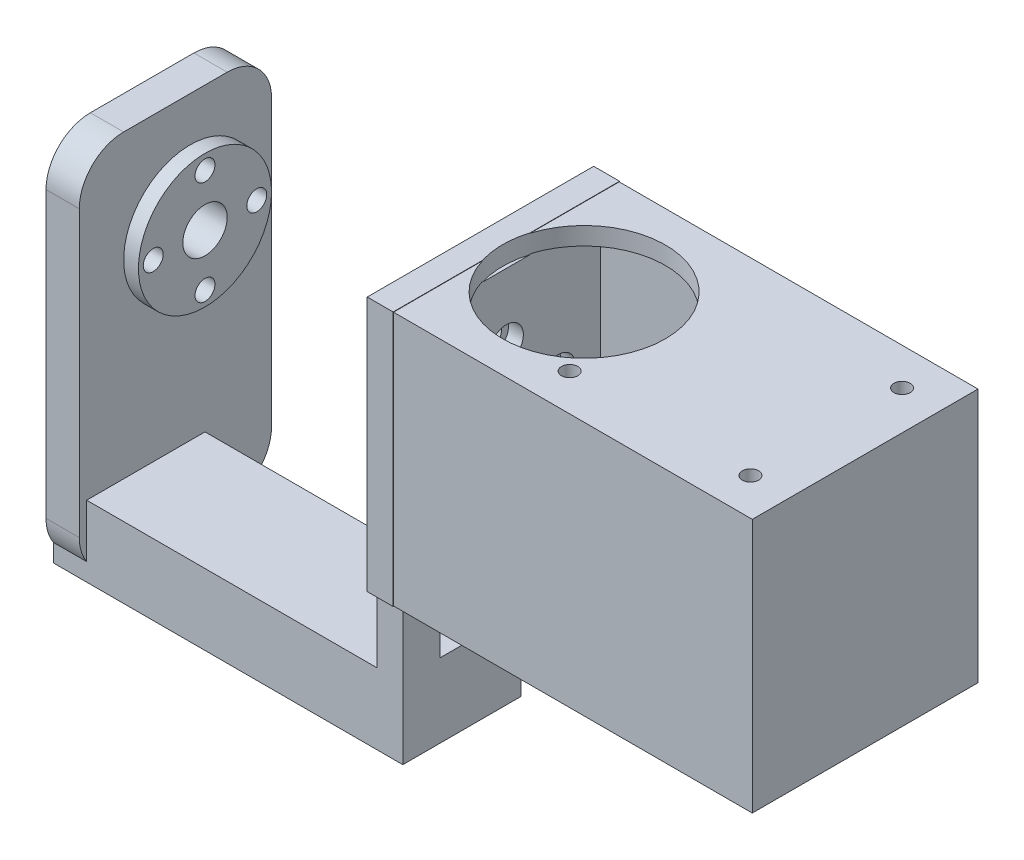
from build123d import *

# Parameters (mm, degrees)
S_PRISM1_W    = 30.62
S_PRISM1_H    = 34.5
BOSS_1_DEPTH  = 3.5
S_CYL2_R      = 9
BOSS_2_DEPTH  = 2
BOSS_3_DEPTH  = 4.5
S_BOX4_W      = 2.5
S_BOX4_H      = 34.4
BOSS_4_DEPTH  = 30.52
S_BOX5_W      = 2.5
S_BOX5_H      = 34.4
BOSS_5_DEPTH  = 30.52
S_BOX6_W      = 51.02
S_BOX6_H      = 34.4
BOSS_6_DEPTH  = 2.5
S_BOX7_W      = 51.02
S_BOX7_H      = 34.4
BOSS_7_DEPTH  = 2.5
S_BOX8_W      = 51.02
S_BOX8_H      = 2.4
BOSS_8_DEPTH  = 30.52
S_BOX9_W      = 3.5
S_BOX9_H      = 9.725
BOSS_9_DEPTH  = 5
S_BOX10_W     = 3.5
S_BOX10_H     = 10
BOSS_10_DEPTH = 16
S_BOX11_W     = 47.25
S_BOX11_H     = 9.6
BOSS_11_DEPTH = 16
S_HOLE12_R    = 3
HOLE_12_DEPTH = 3.7
S_HOLE13_R    = 1.35
HOLE_13_DEPTH = 3.7
S_HOLE14_R    = 1.35
HOLE_14_DEPTH = 3.7
S_HOLE15_R    = 1.35
HOLE_15_DEPTH = 3.7
S_HOLE16_R    = 1.35
HOLE_16_DEPTH = 3.7
S_HOLE17_R    = 3
HOLE_17_DEPTH = 6.7
S_HOLE18_R    = 1.35
HOLE_18_DEPTH = 6.7
S_HOLE19_R    = 1.35
HOLE_19_DEPTH = 6.7
S_HOLE20_R    = 1.35
HOLE_20_DEPTH = 6.7
S_HOLE21_R    = 1.35
HOLE_21_DEPTH = 6.7
S_HOLE22_R    = 11
HOLE_22_DEPTH = 2.6
S_HOLE23_R    = 1.1
HOLE_23_DEPTH = 2.6
S_HOLE24_R    = 1.1
HOLE_24_DEPTH = 2.6
S_HOLE25_R    = 1.1
HOLE_25_DEPTH = 2.6
S_HOLE26_R    = 2.3
HOLE_26_DEPTH = 2.1
S_HOLE27_R    = 2.3
HOLE_27_DEPTH = 2.1
S_HOLE28_R    = 2.3
HOLE_28_DEPTH = 2.1
S_HOLE29_R    = 2.3
HOLE_29_DEPTH = 2.1


with BuildPart() as part:
    # S_prism1 → Boss_1 (new body)
    with BuildSketch(Plane(origin=(-14.01, 0, 0), x_dir=(0, 0, -1), z_dir=(1, 0, 0))):
        with Locations((0, 1.2)):
            Rectangle(S_PRISM1_W, S_PRISM1_H)
    extrude(amount=BOSS_1_DEPTH)

    # S_box4 → Boss_4 (add)
    with BuildSketch(Plane.XY.offset(-15.26)):
        with Locations((-11.76, 1.2)):
            Rectangle(S_BOX4_W, S_BOX4_H)
    extrude(amount=BOSS_4_DEPTH)



with BuildPart() as body_2:
    # S_cyl2 → Boss_2 (new body)
    with BuildSketch(Plane(origin=(-53.26, 0, 0), x_dir=(0, 0, -1), z_dir=(1, 0, 0))):
        Circle(S_CYL2_R)
    extrude(amount=BOSS_2_DEPTH)

    # S_prism3 → Boss_3 (add)
    with BuildSketch(Plane(origin=(-57.76, 0, 0), x_dir=(0, 0, -1), z_dir=(1, 0, 0))):
        with BuildLine():
            Line((11, 9), (11, -29.5))
            ThreePointArc((11, -29.5), (9.2426, -33.7426), (5, -35.5))
            Line((5, -35.5), (-9, -35.5))
            ThreePointArc((-9, -35.5), (-13.2426, -33.7426), (-15, -29.5))
            Line((-15, -29.5), (-15, 9))
            ThreePointArc((-15, 9), (-13.2426, 13.2426), (-9, 15))
            Line((-9, 15), (5, 15))
            ThreePointArc((5, 15), (9.2426, 13.2426), (11, 9))
        make_face()
    extrude(amount=BOSS_3_DEPTH)


with BuildPart() as body_3:
    # S_box5 → Boss_5 (new body)
    with BuildSketch(Plane.XY.offset(-15.26)):
        with Locations((36.76, 1.2)):
            Rectangle(S_BOX5_W, S_BOX5_H)
    extrude(amount=BOSS_5_DEPTH)


with BuildPart() as part_1:
    add(part.part)

    add(body_3.part)  # Boss_6 merges body 3
    # S_box6 → Boss_6 (add)
    with BuildSketch(Plane.XY.offset(-15.26)):
        with Locations((12.5, 1.2)):
            Rectangle(S_BOX6_W, S_BOX6_H)
    extrude(amount=BOSS_6_DEPTH)

    # S_box7 → Boss_7 (add)
    with BuildSketch(Plane.XY.offset(12.76)):
        with Locations((12.5, 1.2)):
            Rectangle(S_BOX7_W, S_BOX7_H)
    extrude(amount=BOSS_7_DEPTH)

    # S_box8 → Boss_8 (add)
    with BuildSketch(Plane.XY.offset(-15.26)):
        with Locations((12.5, 17.2)):
            Rectangle(S_BOX8_W, S_BOX8_H)
    extrude(amount=BOSS_8_DEPTH)

    # S_box9 → Boss_9 (add)
    with BuildSketch(Plane.XY.offset(9)):
        with Locations((-12.26, -20.8625)):
            Rectangle(S_BOX9_W, S_BOX9_H)
    extrude(amount=BOSS_9_DEPTH)

    # S_box10 → Boss_10 (add)
    with BuildSketch(Plane.XY.offset(-2)):
        with Locations((-12.26, -30.225)):
            Rectangle(S_BOX10_W, S_BOX10_H)
    extrude(amount=BOSS_10_DEPTH)


    add(body_2.part)  # Boss_11 merges body 2
    # S_box11 → Boss_11 (add)
    with BuildSketch(Plane.XY.offset(-2)):
        with Locations((-34.135, -30.425)):
            Rectangle(S_BOX11_W, S_BOX11_H)
    extrude(amount=BOSS_11_DEPTH)

    # S_hole12 → Hole_12 (cut)
    with BuildSketch(Plane(origin=(-14.11, 0, 0), x_dir=(0, 0, -1), z_dir=(1, 0, 0))):
        Circle(S_HOLE12_R)
    extrude(amount=HOLE_12_DEPTH, mode=Mode.SUBTRACT)

    # S_hole13 → Hole_13 (cut)
    with BuildSketch(Plane(origin=(-14.11, 0, 0), x_dir=(0, 0, -1), z_dir=(1, 0, 0))):
        with Locations((0, -7)):
            Circle(S_HOLE13_R)
    extrude(amount=HOLE_13_DEPTH, mode=Mode.SUBTRACT)

    # S_hole14 → Hole_14 (cut)
    with BuildSketch(Plane(origin=(-14.11, 0, 0), x_dir=(0, 0, -1), z_dir=(1, 0, 0))):
        with Locations((-7, 0)):
            Circle(S_HOLE14_R)
    extrude(amount=HOLE_14_DEPTH, mode=Mode.SUBTRACT)

    # S_hole15 → Hole_15 (cut)
    with BuildSketch(Plane(origin=(-14.11, 0, 0), x_dir=(0, 0, -1), z_dir=(1, 0, 0))):
        with Locations((0, 7)):
            Circle(S_HOLE15_R)
    extrude(amount=HOLE_15_DEPTH, mode=Mode.SUBTRACT)

    # S_hole16 → Hole_16 (cut)
    with BuildSketch(Plane(origin=(-14.11, 0, 0), x_dir=(0, 0, -1), z_dir=(1, 0, 0))):
        with Locations((7, 0)):
            Circle(S_HOLE16_R)
    extrude(amount=HOLE_16_DEPTH, mode=Mode.SUBTRACT)

    # S_hole17 → Hole_17 (cut)
    with BuildSketch(Plane(origin=(-57.86, 0, 0), x_dir=(0, 0, -1), z_dir=(1, 0, 0))):
        Circle(S_HOLE17_R)
    extrude(amount=HOLE_17_DEPTH, mode=Mode.SUBTRACT)

    # S_hole18 → Hole_18 (cut)
    with BuildSketch(Plane(origin=(-57.86, 0, 0), x_dir=(0, 0, -1), z_dir=(1, 0, 0))):
        with Locations((0, -7)):
            Circle(S_HOLE18_R)
    extrude(amount=HOLE_18_DEPTH, mode=Mode.SUBTRACT)

    # S_hole19 → Hole_19 (cut)
    with BuildSketch(Plane(origin=(-57.86, 0, 0), x_dir=(0, 0, -1), z_dir=(1, 0, 0))):
        with Locations((-7, 0)):
            Circle(S_HOLE19_R)
    extrude(amount=HOLE_19_DEPTH, mode=Mode.SUBTRACT)

    # S_hole20 → Hole_20 (cut)
    with BuildSketch(Plane(origin=(-57.86, 0, 0), x_dir=(0, 0, -1), z_dir=(1, 0, 0))):
        with Locations((0, 7)):
            Circle(S_HOLE20_R)
    extrude(amount=HOLE_20_DEPTH, mode=Mode.SUBTRACT)

    # S_hole21 → Hole_21 (cut)
    with BuildSketch(Plane(origin=(-57.86, 0, 0), x_dir=(0, 0, -1), z_dir=(1, 0, 0))):
        with Locations((7, 0)):
            Circle(S_HOLE21_R)
    extrude(amount=HOLE_21_DEPTH, mode=Mode.SUBTRACT)

    # S_hole22 → Hole_22 (cut)
    with BuildSketch(Plane(origin=(0, 15.9, 0), x_dir=(1, 0, 0), z_dir=(0, 1, 0))):
        Circle(S_HOLE22_R)
    extrude(amount=HOLE_22_DEPTH, mode=Mode.SUBTRACT)

    # S_hole23 → Hole_23 (cut)
    with BuildSketch(Plane(origin=(0, 15.9, 0), x_dir=(1, 0, 0), z_dir=(0, 1, 0))):
        with Locations((8.3, -10.25)):
            Circle(S_HOLE23_R)
    extrude(amount=HOLE_23_DEPTH, mode=Mode.SUBTRACT)

    # S_hole24 → Hole_24 (cut)
    with BuildSketch(Plane(origin=(0, 15.9, 0), x_dir=(1, 0, 0), z_dir=(0, 1, 0))):
        with Locations((32.75, 10.25)):
            Circle(S_HOLE24_R)
    extrude(amount=HOLE_24_DEPTH, mode=Mode.SUBTRACT)

    # S_hole25 → Hole_25 (cut)
    with BuildSketch(Plane(origin=(0, 15.9, 0), x_dir=(1, 0, 0), z_dir=(0, 1, 0))):
        with Locations((32.75, -10.25)):
            Circle(S_HOLE25_R)
    extrude(amount=HOLE_25_DEPTH, mode=Mode.SUBTRACT)

    # S_hole26 → Hole_26 (cut)
    with BuildSketch(Plane(origin=(-12.51, 0, 0), x_dir=(0, 0, -1), z_dir=(1, 0, 0))):
        with Locations((0, -7)):
            Circle(S_HOLE26_R)
    extrude(amount=HOLE_26_DEPTH, mode=Mode.SUBTRACT)

    # S_hole27 → Hole_27 (cut)
    with BuildSketch(Plane(origin=(-12.51, 0, 0), x_dir=(0, 0, -1), z_dir=(1, 0, 0))):
        with Locations((-7, 0)):
            Circle(S_HOLE27_R)
    extrude(amount=HOLE_27_DEPTH, mode=Mode.SUBTRACT)

    # S_hole28 → Hole_28 (cut)
    with BuildSketch(Plane(origin=(-12.51, 0, 0), x_dir=(0, 0, -1), z_dir=(1, 0, 0))):
        with Locations((0, 7)):
            Circle(S_HOLE28_R)
    extrude(amount=HOLE_28_DEPTH, mode=Mode.SUBTRACT)

    # S_hole29 → Hole_29 (cut)
    with BuildSketch(Plane(origin=(-12.51, 0, 0), x_dir=(0, 0, -1), z_dir=(1, 0, 0))):
        with Locations((7, 0)):
            Circle(S_HOLE29_R)
    extrude(amount=HOLE_29_DEPTH, mode=Mode.SUBTRACT)


solid = part_1.part
